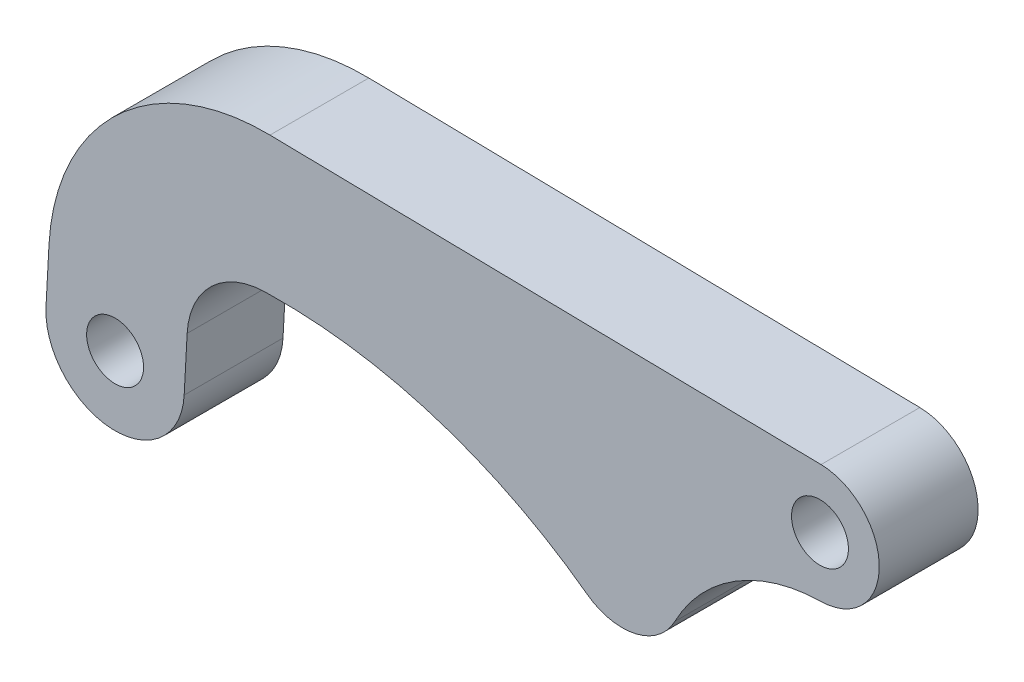
from build123d import *

# Parameters (mm, degrees)
SKETCH1_R           = 2.286
BOSS_EXTRUDE1_DEPTH = 3.96875


with BuildPart() as part:
    # Sketch1 → Boss-Extrude1 (new, symmetric)
    with BuildSketch(Plane.XY):
        with BuildLine():
            Line((56.691207636, 20.440706917), (12.438907634, 21.230538216))
            ThreePointArc((12.438907634, 21.230538216), (0.230624537, 16.553952096), (-5.309802459, 4.712655604))
            Line((-5.309802459, 4.712655604), (-5.54816265, 0.299675278))
            ThreePointArc((-5.54816265, 0.299675278), (-0.299675278, -5.54816265), (5.54816265, -0.299675278))
            Line((5.54816265, -0.299675278), (5.786522841, 4.113305048))
            ThreePointArc((5.786522841, 4.113305048), (7.718959113, 8.341290062), (12.013961072, 10.119807816))
            Line((12.013961072, 10.119807816), (12.438907634, 10.127392418))
            ThreePointArc((12.438907634, 10.127392418), (25.840688586, 8.170983506), (37.91246846, 2.030348427))
            ThreePointArc((37.91246846, 2.030348427), (41.807228225, 1.22975108), (44.951953603, 3.663022958))
            ThreePointArc((44.951953603, 3.663022958), (49.826214383, 8.90089446), (56.691207636, 10.917223717))
            ThreePointArc((56.691207636, 10.917223717), (61.368718323, 15.678965317), (56.691207636, 20.440706917))
        make_face()
        Circle(SKETCH1_R, mode=Mode.SUBTRACT)
        with Locations((56.606218323, 15.678965317)):
            Circle(SKETCH1_R, mode=Mode.SUBTRACT)
    extrude(amount=BOSS_EXTRUDE1_DEPTH, both=True)


solid = part.part
